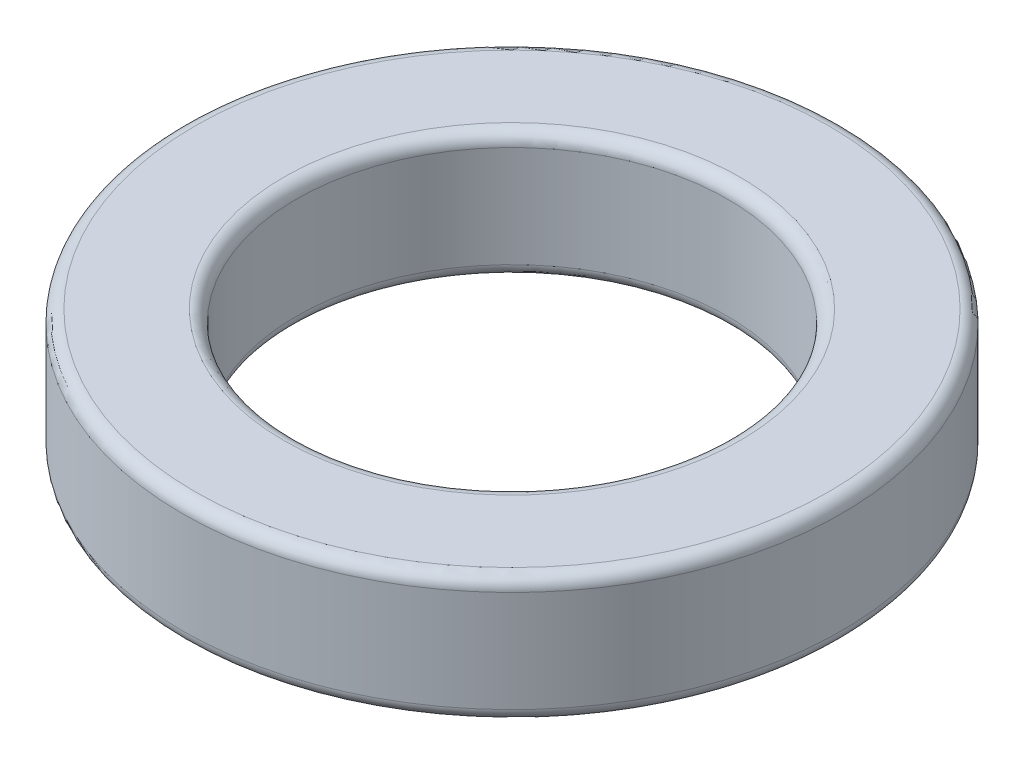
from build123d import *

# Parameters (mm, degrees)
SKETCH_1_R      = 13
SKETCH_1_R_2    = 8.5
EXTRUDE_1_DEPTH = 5
FILLET_1_R      = 0.5


with BuildPart() as part:
    # Эскиз1 → Бобышка-Вытянуть1 (new body)
    with BuildSketch(Plane(origin=(0, 0, 0), x_dir=(1, 0, 0), z_dir=(0, 1, 0))):
        Circle(SKETCH_1_R)
        Circle(SKETCH_1_R_2, mode=Mode.SUBTRACT)
    extrude(amount=EXTRUDE_1_DEPTH)

    # Скругление1
    fillet_1_edges = [part.edges().sort_by_distance(p)[0] for p in [
        (-8.5, 0, 0),
        (-13, 0, 0),
        (-8.5, 5, 0),
        (-13, 5, 0),
    ]]
    fillet(fillet_1_edges, radius=FILLET_1_R)


solid = part.part
